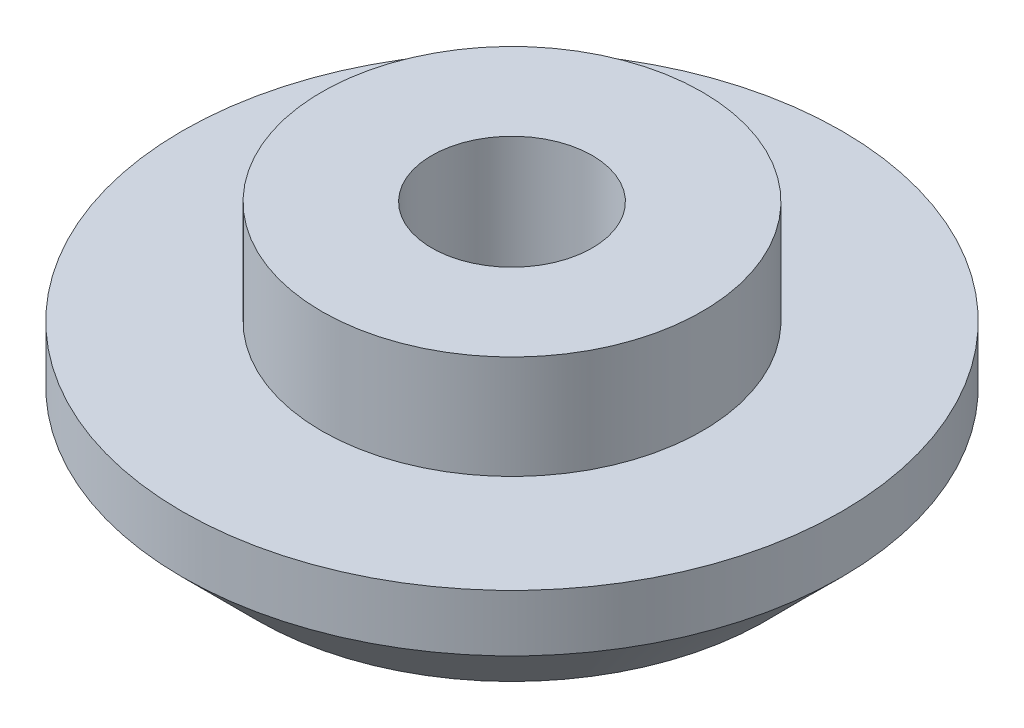
from build123d import *

# Parameters (mm, degrees)
SKETCH2_R          = 1.5
CUT_EXTRUDE1_DEPTH = 10.513735212


with BuildPart() as part:
    # Sketch1 → Revolve1 (revolve)
    with BuildSketch(Plane.XY):
        Polygon((0, 0.6), (2.75, 0.6), (2.75, 0), (4.75, 0), (6.164213562, 1.414213562), (6.164213562, 2.475397075), (3.556, 2.475397075), (3.556, 4.41), (0, 4.41), align=None)
    revolve(axis=Axis((0, 4.41, 0), (0, -1, 0)))

    # Sketch2 → Cut-Extrude1 (cut, through all)
    with BuildSketch(Plane.XZ.offset(-0.6)):
        Circle(SKETCH2_R)
    extrude(amount=-CUT_EXTRUDE1_DEPTH, mode=Mode.SUBTRACT)


solid = part.part
